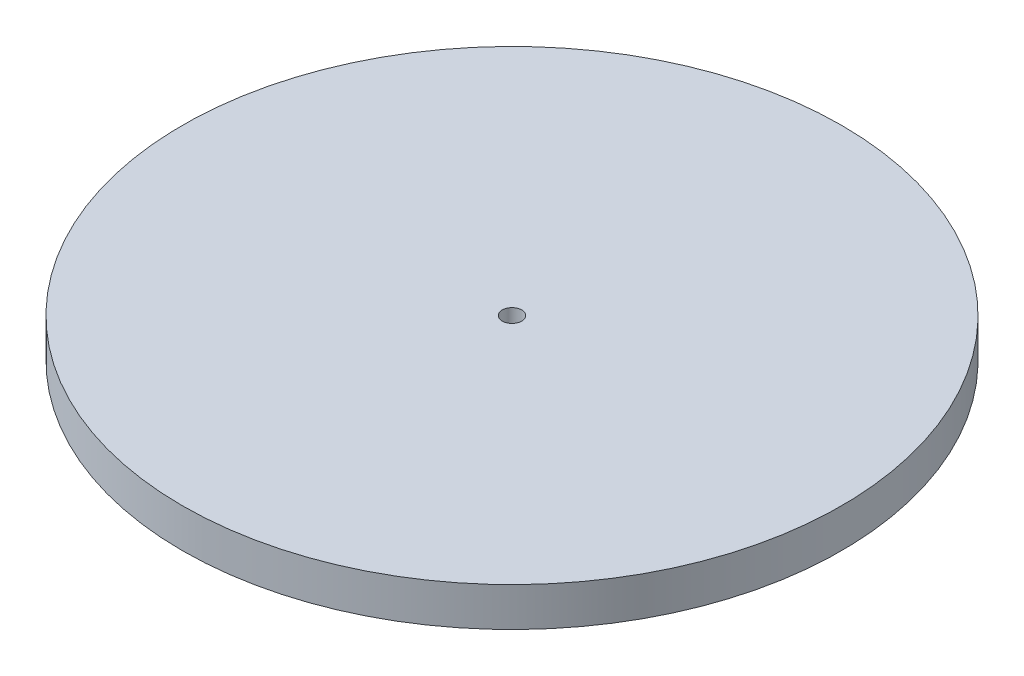
from build123d import *

# Parameters (mm, degrees)
SKETCH1_R           = 25.4
BOSS_EXTRUDE1_DEPTH = 1.5
SKETCH2_R           = 0.75
CUT_EXTRUDE1_DEPTH  = 37.046081618


with BuildPart() as part:
    # Sketch1 → Boss-Extrude1 (new, symmetric)
    with BuildSketch(Plane(origin=(0, 0, 0), x_dir=(1, 0, 0), z_dir=(0, 1, 0))):
        Circle(SKETCH1_R)
    extrude(amount=BOSS_EXTRUDE1_DEPTH, both=True)

    # Sketch2 → Cut-Extrude1 (cut, through all)
    with BuildSketch(Plane(origin=(0, 1.5, 0), x_dir=(1, 0, 0), z_dir=(0, 1, 0))):
        Circle(SKETCH2_R)
    extrude(amount=-CUT_EXTRUDE1_DEPTH, mode=Mode.SUBTRACT)


solid = part.part
